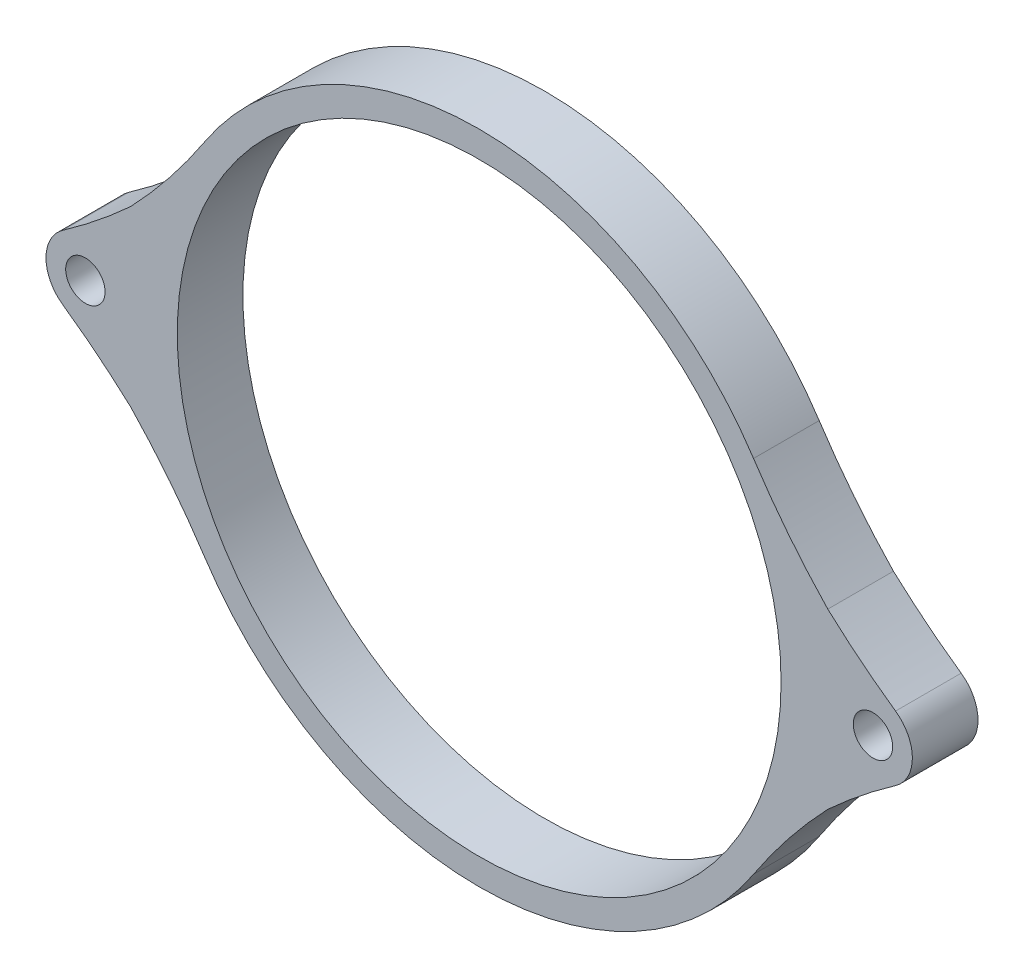
from build123d import *

# Parameters (mm, degrees)
ESQUISSE1_R        = 25
ESQUISSE1_R_2      = 23
ESQUISSE1_R_3      = 3
ESQUISSE1_R_4      = 1.5
BOSS_EXTRU_1_DEPTH = 5
CONG_1_R           = 50
CONG_2_R           = 50


with BuildPart() as part:
    # Esquisse1 → Boss.-Extru.1 (new body)
    # profile 1 of 5: a face of its own
    with BuildSketch(Plane.XY):
        Circle(ESQUISSE1_R)
        Circle(ESQUISSE1_R_2, mode=Mode.SUBTRACT)
    # profile 2 of 5: a face of its own
    with BuildSketch(Plane.XY):
        with BuildLine():
            Line((30, 3), (22.547920633, 10.797743982))
            ThreePointArc((22.547920633, 10.797743982), (24.379274147, 5.536333812), (25, 0))
            ThreePointArc((25, 0), (24.379274147, -5.536333812), (22.547920633, -10.797743982))
            Line((22.547920633, -10.797743982), (30, -3))
            ThreePointArc((30, -3), (27, 0), (30, 3))
        make_face()
    # profile 3 of 5: a face of its own
    with BuildSketch(Plane.XY):
        with Locations((30, 0)):
            Circle(ESQUISSE1_R_3)
        with Locations((30, 0)):
            Circle(ESQUISSE1_R_4, mode=Mode.SUBTRACT)
    # profile 4 of 5: a face of its own
    with BuildSketch(Plane.XY):
        with Locations((-30, 0)):
            Circle(ESQUISSE1_R_3)
        with Locations((-30, 0)):
            Circle(ESQUISSE1_R_4, mode=Mode.SUBTRACT)
    # profile 5 of 5: a face of its own
    with BuildSketch(Plane.XY):
        with BuildLine():
            Line((-22.547920633, 10.797743982), (-30, 3))
            ThreePointArc((-30, 3), (-27.878679656, 2.121320344), (-27, 0))
            ThreePointArc((-27, 0), (-27.878679656, -2.121320344), (-30, -3))
            Line((-30, -3), (-22.547920633, -10.797743982))
            ThreePointArc((-22.547920633, -10.797743982), (-25, 0), (-22.547920633, 10.797743982))
        make_face()
    extrude(amount=BOSS_EXTRU_1_DEPTH)

    # Congé1
    cong_1_edges = [part.edges().sort_by_distance(p)[0] for p in [
        (22.547920633, -10.797743982, 2.5),
        (-22.547920633, -10.797743982, 2.5),
        (-22.547920633, 10.797743982, 2.5),
        (22.547920633, 10.797743982, 2.5),
    ]]
    fillet(cong_1_edges, radius=CONG_1_R)

    # Congé2
    # the kernel refuses this fillet: 50 mm, written as the material it adds along each edge
    with BuildSketch(Plane(origin=(-30, 3, 0), x_dir=(0.690901472787751, 0.722948929662197, 0), z_dir=(0, 0, 1))) as cong_2_piece_1:
        with BuildLine():
            CenterArc((8.249869656, 49.8931531), CONG_2_R, 258.662988377, 7.590639101)
            Line((-1.579108122, 0.868759215), (-1.775687678, -0.111728663))
            ThreePointArc((-1.775687678, -0.111728663), (-1.20479652, -0.320389641), (-0.72294893, -0.690901473))
            Line((-0.72294893, -0.690901473), (0, -1))
            ThreePointArc((0, -1), (2.491435997, -1), (4.917532041, -0.997863062))
            Line((4.917532041, -0.997863062), (4.982871995, 0))
        make_face()
    extrude(amount=5)
    with BuildSketch(Plane(origin=(-30, -3, 0), x_dir=(-0.9538179852697427, 0.30038517103207485, 0), z_dir=(0, 0, 1))) as cong_2_piece_2:
        with BuildLine():
            CenterArc((16.821569578, 47.690899263), CONG_2_R, 244.928622049, 7.590639101)
            Line((-4.365780115, 2.401869543), (-4.789527109, 1.496088949))
            ThreePointArc((-4.789527109, 1.496088949), (-2.664915192, 0.324777383), (-0.482025134, -0.876157389))
            Line((-0.482025134, -0.876157389), (0.300385171, -0.953817985))
            ThreePointArc((0.300385171, -0.953817985), (0.901155513, -0.861453956), (1.501925855, -0.953817985))
            Line((1.501925855, -0.953817985), (1.802311026, 0))
        make_face()
    extrude(amount=5)
    with BuildSketch(Plane(origin=(30, -3, 0), x_dir=(0.9538179852697404, 0.30038517103208245, 0), z_dir=(0, 0, 1))) as cong_2_piece_3:
        with BuildLine():
            CenterArc((16.821569578, -47.690899263), CONG_2_R, 107.48073885, 7.590639101)
            Line((-4.365780115, -2.401869543), (-4.789527109, -1.496088949))
            ThreePointArc((-4.789527109, -1.496088949), (-2.664915192, -0.324777383), (-0.482025134, 0.876157389))
            Line((-0.482025134, 0.876157389), (0.300385171, 0.953817985))
            ThreePointArc((0.300385171, 0.953817985), (0.901155513, 0.861453956), (1.501925855, 0.953817985))
            Line((1.501925855, 0.953817985), (1.802311026, 0))
        make_face()
    extrude(amount=5)
    with BuildSketch(Plane(origin=(30, 3, 0), x_dir=(-0.6909014727877525, 0.7229489296621958, 0), z_dir=(0, 0, 1))) as cong_2_piece_4:
        with BuildLine():
            CenterArc((8.249869656, -49.8931531), CONG_2_R, 93.746372522, 7.590639101)
            Line((-1.579108122, -0.868759215), (-1.775687678, 0.111728663))
            ThreePointArc((-1.775687678, 0.111728663), (-1.20479652, 0.320389641), (-0.72294893, 0.690901473))
            Line((-0.72294893, 0.690901473), (0, 1))
            ThreePointArc((0, 1), (2.491435997, 1), (4.917532041, 0.997863062))
            Line((4.917532041, 0.997863062), (4.982871995, 0))
        make_face()
    extrude(amount=5)


solid = part.part
